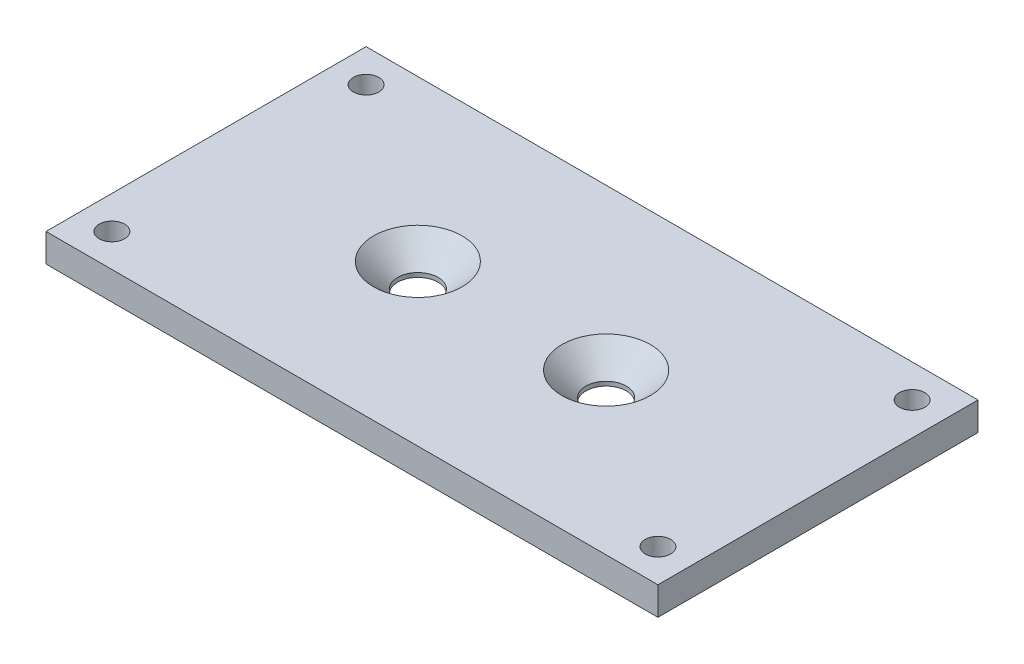
from build123d import *

# Parameters (mm, degrees)
SKETCH1_W              = 65
SKETCH1_H              = 34
SKETCH1_R              = 0.5
BOSS_EXTRUDE1_DEPTH    = 3
M2_5_CLEARANCE_HOLE1_D = 2.7


# Read off the part's stored shape, not the designer's step: CSK for M4 Flat Head Machine Screw1
with BuildPart() as part:
    # Sketch1 → Boss-Extrude1 (new body)
    with BuildSketch(Plane(origin=(0, 0, 0), x_dir=(1, 0, 0), z_dir=(0, 1, 0))):
        Rectangle(SKETCH1_W, SKETCH1_H)
        with Locations(Location((-29, -13.5, 0), (0, 0, 270))):
            Circle(SKETCH1_R, mode=Mode.SUBTRACT)
        with Locations(Location((-29, 13.5, 0), (0, 0, 270))):
            Circle(SKETCH1_R, mode=Mode.SUBTRACT)
        with Locations(Location((29, -13.5, 0), (0, 0, 270))):
            Circle(SKETCH1_R, mode=Mode.SUBTRACT)
        with Locations(Location((29, 13.5, 0), (0, 0, 270))):
            Circle(SKETCH1_R, mode=Mode.SUBTRACT)
        with Locations(Location((-10, 0, 0), (0, 0, 270))):
            Circle(SKETCH1_R, mode=Mode.SUBTRACT)
        with Locations(Location((10, 0, 0), (0, 0, 270))):
            Circle(SKETCH1_R, mode=Mode.SUBTRACT)
    extrude(amount=BOSS_EXTRUDE1_DEPTH)

    # M2.5 Clearance Hole1 (through all)
    with Locations(Plane(origin=(0, 3, 0), x_dir=(1, 0, 0), z_dir=(0, 1, 0))):
        with Locations((-29, -13.5), (-29, 13.5), (29, 13.5), (29, -13.5)):
            Hole(M2_5_CLEARANCE_HOLE1_D / 2)

    # CSK for M4 Flat Head Machine Screw1 outl → CSK for M4 Flat Head Machine Screw1 (revolve, cut)
    with BuildSketch(Plane(origin=(10, 0, 0), x_dir=(1, 0, 0), z_dir=(0, 0, 1))):
        Polygon((0.5, 0), (2.15, 0), (2.15, 0.45), (4.7, 3), (0.5, 3), align=None)
    revolve(axis=Axis((10, 0, 0), (0, 1, 0)), mode=Mode.SUBTRACT)

    # CSK for M4 Flat Head Machine Screw1 2 ou → CSK for M4 Flat Head Machine Screw1 2 (revolve, cut)
    with BuildSketch(Plane(origin=(-10, 0, 0), x_dir=(1, 0, 0), z_dir=(0, 0, 1))):
        Polygon((0.5, 0), (2.15, 0), (2.15, 0.45), (4.7, 3), (0.5, 3), align=None)
    revolve(axis=Axis((-10, 0, 0), (0, 1, 0)), mode=Mode.SUBTRACT)


solid = part.part
